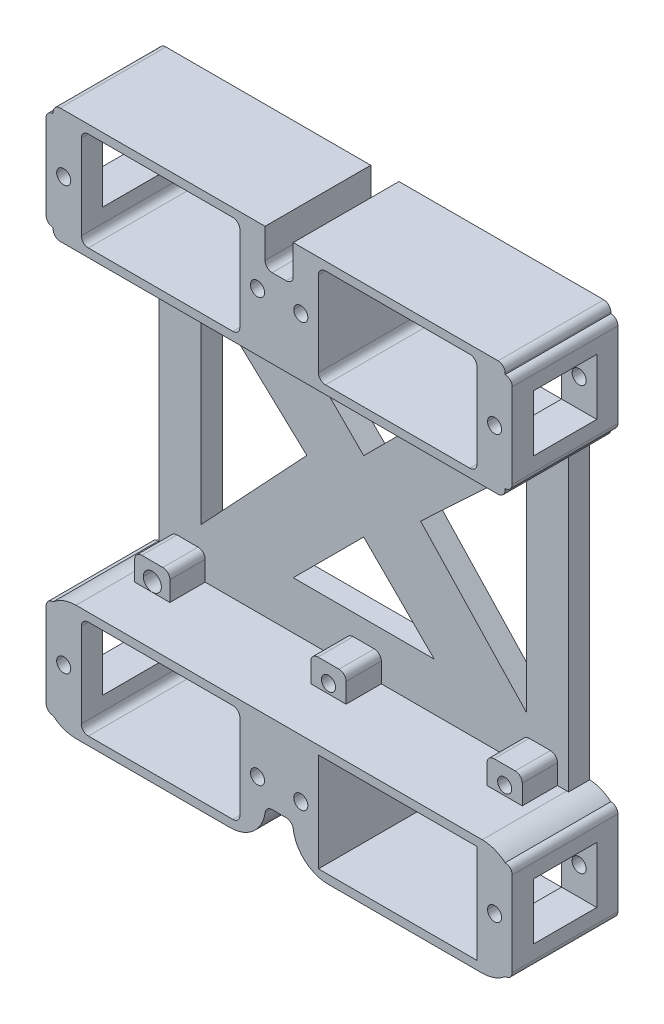
from build123d import *

# Parameters (mm, degrees)
BOSS_EXTRUDE2_START         = -15
BOSS_EXTRUDE2_OUTLINE_R     = 1
BOSS_EXTRUDE2_DEPTH         = 15
BOSS_EXTRUDE2_2_OUTLINE_W   = 58.142598029
BOSS_EXTRUDE2_2_OUTLINE_H   = 43.583150067
BOSS_EXTRUDE2_2_OUTLINE_R   = 1
BOSS_EXTRUDE2_2_OUTLINE_W_2 = 5
BOSS_EXTRUDE2_2_OUTLINE_H_2 = 8
BOSS_EXTRUDE2_2_DEPTH       = 3
BOSS_EXTRUDE2_START_2       = -12
BOSS_EXTRUDE2_3_OUTLINE_R   = 1
BOSS_EXTRUDE2_3_DEPTH       = 5
BOSS_EXTRUDE2_START_3       = -3
BOSS_EXTRUDE2_4_OUTLINE_W   = 5
BOSS_EXTRUDE2_4_OUTLINE_H   = 8
BOSS_EXTRUDE2_4_OUTLINE_R   = 1
BOSS_EXTRUDE2_4_DEPTH       = 3
CUT_EXTRUDE1_DEPTH          = 386.013637335
FILLET1_R                   = 5
FILLET2_R                   = 5
SKETCH3_W                   = 22.5
SKETCH3_H                   = 1
CUT_EXTRUDE2_DEPTH          = 386.013637462
FILLET3_R                   = 1
SKETCH4_W                   = 4
SKETCH4_H                   = 1.2
CUT_EXTRUDE3_DEPTH          = 386.013637462
FILLET4_R                   = 1
FILLET5_R                   = 1


with BuildPart() as part:
    # Boss-Extrude2: read off the stored shape, not the designer's step
    # Boss-Extrude2 outline → Boss-Extrude2 (new body)
    # profile 1 of 2: a face of its own
    with BuildSketch(Plane.XY.offset(95).offset(BOSS_EXTRUDE2_START)):
        with BuildLine():
            Line((-36.215449014, 311.14627107), (-100.358047043, 311.14627107))
            Line((-100.358047043, 311.14627107), (-100.358047043, 309.94627107))
            ThreePointArc((-100.358047043, 309.94627107), (-101.065153824, 309.653377852), (-101.358047043, 308.94627107))
            Line((-101.358047043, 308.94627107), (-101.358047043, 306.94627107))
            Line((-101.358047043, 306.94627107), (-96.358047043, 306.94627107))
            Line((-96.358047043, 306.94627107), (-96.358047043, 308.94627107))
            Line((-96.358047043, 308.94627107), (-73.858047043, 308.94627107))
            Line((-73.858047043, 308.94627107), (-73.858047043, 296.94627107))
            Line((-73.858047043, 296.94627107), (-96.358047043, 296.94627107))
            Line((-96.358047043, 296.94627107), (-96.358047043, 298.94627107))
            Line((-96.358047043, 298.94627107), (-101.358047043, 298.94627107))
            Line((-101.358047043, 298.94627107), (-101.358047043, 296.94627107))
            ThreePointArc((-101.358047043, 296.94627107), (-101.065153825, 296.239164288), (-100.358047043, 295.94627107))
            Line((-100.358047043, 295.94627107), (-100.358047043, 294.74627107))
            Line((-100.358047043, 294.74627107), (-36.215449014, 294.74627107))
            Line((-36.215449014, 294.74627107), (-36.215449014, 295.94627107))
            ThreePointArc((-36.215449014, 295.94627107), (-35.508342233, 296.239164289), (-35.215449014, 296.94627107))
            Line((-35.215449014, 296.94627107), (-35.215449014, 298.94627107))
            Line((-35.215449014, 298.94627107), (-40.215449014, 298.94627107))
            Line((-40.215449014, 298.94627107), (-40.215449014, 296.94627107))
            Line((-40.215449014, 296.94627107), (-62.715449014, 296.94627107))
            Line((-62.715449014, 296.94627107), (-62.715449014, 308.94627107))
            Line((-62.715449014, 308.94627107), (-40.215449014, 308.94627107))
            Line((-40.215449014, 308.94627107), (-40.215449014, 306.94627107))
            Line((-40.215449014, 306.94627107), (-35.215449014, 306.94627107))
            Line((-35.215449014, 306.94627107), (-35.215449014, 308.94627107))
            ThreePointArc((-35.215449014, 308.94627107), (-35.508342233, 309.653377851), (-36.215449014, 309.94627107))
            Line((-36.215449014, 309.94627107), (-36.215449014, 311.14627107))
        make_face()
        with BuildLine():
            Line((-71.254377112, 295.94627107), (-71.286747043, 295.94627107))
            ThreePointArc((-71.286747043, 295.94627107), (-71.270298041, 295.946406364), (-71.253853489, 295.946812209))
            Line((-71.253853489, 295.946812209), (-71.254377112, 295.94627107))
        make_face(mode=Mode.SUBTRACT)
        with Locations((-71.358047043, 302.94627107)):
            Circle(BOSS_EXTRUDE2_OUTLINE_R, mode=Mode.SUBTRACT)
        with BuildLine():
            Line((-70.286747043, 295.94627107), (-70.286747043, 298.94627107))
            ThreePointArc((-70.286747043, 298.94627107), (-69.993853824, 299.653377852), (-69.286747043, 299.94627107))
            Line((-69.286747043, 299.94627107), (-67.286747043, 299.94627107))
            ThreePointArc((-67.286747043, 299.94627107), (-66.579640262, 299.653377851), (-66.286747043, 298.94627107))
            Line((-66.286747043, 298.94627107), (-66.286747043, 295.94627107))
            Line((-66.286747043, 295.94627107), (-70.286747043, 295.94627107))
        make_face(mode=Mode.SUBTRACT)
        with Locations((-65.215449014, 302.94627107)):
            Circle(BOSS_EXTRUDE2_OUTLINE_R, mode=Mode.SUBTRACT)
    # profile 2 of 2: a face of its own
    with BuildSketch(Plane.XY.offset(95).offset(BOSS_EXTRUDE2_START)):
        with BuildLine():
            Line((-100.358047043, 354.729421137), (-36.215449014, 354.729421137))
            Line((-36.215449014, 354.729421137), (-36.215449014, 355.929421137))
            ThreePointArc((-36.215449014, 355.929421137), (-35.508342232, 356.222314355), (-35.215449014, 356.929421137))
            Line((-35.215449014, 356.929421137), (-35.215449014, 358.929421137))
            Line((-35.215449014, 358.929421137), (-40.215449014, 358.929421137))
            Line((-40.215449014, 358.929421137), (-40.215449014, 356.929421137))
            Line((-40.215449014, 356.929421137), (-62.715449014, 356.929421137))
            Line((-62.715449014, 356.929421137), (-62.715449014, 368.929421137))
            Line((-62.715449014, 368.929421137), (-40.215449014, 368.929421137))
            Line((-40.215449014, 368.929421137), (-40.215449014, 366.929421137))
            Line((-40.215449014, 366.929421137), (-35.215449014, 366.929421137))
            Line((-35.215449014, 366.929421137), (-35.215449014, 368.929421137))
            ThreePointArc((-35.215449014, 368.929421137), (-35.508342233, 369.636527918), (-36.215449014, 369.929421137))
            Line((-36.215449014, 369.929421137), (-36.215449014, 371.129421137))
            Line((-36.215449014, 371.129421137), (-100.358047043, 371.129421137))
            Line((-100.358047043, 371.129421137), (-100.358047043, 369.929421137))
            ThreePointArc((-100.358047043, 369.929421137), (-101.065153824, 369.636527919), (-101.358047043, 368.929421137))
            Line((-101.358047043, 368.929421137), (-101.358047043, 366.929421137))
            Line((-101.358047043, 366.929421137), (-96.358047043, 366.929421137))
            Line((-96.358047043, 366.929421137), (-96.358047043, 368.929421137))
            Line((-96.358047043, 368.929421137), (-73.858047043, 368.929421137))
            Line((-73.858047043, 368.929421137), (-73.858047043, 356.929421137))
            Line((-73.858047043, 356.929421137), (-96.358047043, 356.929421137))
            Line((-96.358047043, 356.929421137), (-96.358047043, 358.929421137))
            Line((-96.358047043, 358.929421137), (-101.358047043, 358.929421137))
            Line((-101.358047043, 358.929421137), (-101.358047043, 356.929421137))
            ThreePointArc((-101.358047043, 356.929421137), (-101.065153825, 356.222314355), (-100.358047043, 355.929421137))
            Line((-100.358047043, 355.929421137), (-100.358047043, 354.729421137))
        make_face()
        with Locations((-71.358047043, 362.929421137)):
            Circle(BOSS_EXTRUDE2_OUTLINE_R, mode=Mode.SUBTRACT)
        with BuildLine():
            Line((-71.254377112, 369.929421137), (-71.253853489, 369.928879997))
            ThreePointArc((-71.253853489, 369.928879997), (-71.270298041, 369.929285843), (-71.286747043, 369.929421137))
            Line((-71.286747043, 369.929421137), (-71.254377112, 369.929421137))
        make_face(mode=Mode.SUBTRACT)
        with Locations((-65.215449014, 362.929421137)):
            Circle(BOSS_EXTRUDE2_OUTLINE_R, mode=Mode.SUBTRACT)
        with BuildLine():
            Line((-70.286747043, 366.929421137), (-70.286747043, 369.929421137))
            Line((-70.286747043, 369.929421137), (-66.286747043, 369.929421137))
            Line((-66.286747043, 369.929421137), (-66.286747043, 366.929421137))
            ThreePointArc((-66.286747043, 366.929421137), (-66.579640261, 366.222314355), (-67.286747043, 365.929421137))
            Line((-67.286747043, 365.929421137), (-69.286747043, 365.929421137))
            ThreePointArc((-69.286747043, 365.929421137), (-69.993853825, 366.222314355), (-70.286747043, 366.929421137))
        make_face(mode=Mode.SUBTRACT)
    extrude(amount=BOSS_EXTRUDE2_DEPTH)

    # Boss-Extrude2 2 outline → Boss-Extrude2 2 (add)
    # profile 1 of 5: a face of its own
    with BuildSketch(Plane.XY.offset(95).offset(BOSS_EXTRUDE2_START)):
        with Locations((-68.286748028, 332.937846104)):
            Rectangle(BOSS_EXTRUDE2_2_OUTLINE_W, BOSS_EXTRUDE2_2_OUTLINE_H)
        Polygon((-78.286747043, 317.937846137), (-68.286747043, 327.937846137), (-58.286747043, 317.937846137), align=None, mode=Mode.SUBTRACT)
        Polygon((-91.358047043, 347.937846137), (-76.358047043, 333.93298957), (-91.358047043, 317.937846137), align=None, mode=Mode.SUBTRACT)
        Polygon((-45.215447043, 347.937846137), (-45.215447043, 317.937846137), (-60.215447043, 333.93298957), align=None, mode=Mode.SUBTRACT)
        Polygon((-68.286747043, 337.937846137), (-78.286747043, 347.937846137), (-58.286747043, 347.937846137), align=None, mode=Mode.SUBTRACT)
        with Locations((-93.286747043, 353.429421137)):
            Circle(BOSS_EXTRUDE2_2_OUTLINE_R, mode=Mode.SUBTRACT)
        with Locations((-68.286747043, 353.429421137)):
            Circle(BOSS_EXTRUDE2_2_OUTLINE_R, mode=Mode.SUBTRACT)
        with Locations((-43.286747043, 353.429421137)):
            Circle(BOSS_EXTRUDE2_2_OUTLINE_R, mode=Mode.SUBTRACT)
        with Locations((-43.286747043, 312.44627107)):
            Circle(BOSS_EXTRUDE2_2_OUTLINE_R, mode=Mode.SUBTRACT)
        with Locations((-68.286747043, 312.44627107)):
            Circle(BOSS_EXTRUDE2_2_OUTLINE_R, mode=Mode.SUBTRACT)
        with BuildLine():
            ThreePointArc((-92.00268291, 312.44627107), (-93.286747044, 311.162206937), (-94.570811177, 312.44627107))
            ThreePointArc((-94.570811177, 312.44627107), (-93.286747044, 313.730335203), (-92.00268291, 312.44627107))
        make_face(mode=Mode.SUBTRACT)
    # profile 2 of 5: a face of its own
    with BuildSketch(Plane.XY.offset(95).offset(BOSS_EXTRUDE2_START)):
        with Locations((-98.858047043, 302.94627107)):
            Rectangle(BOSS_EXTRUDE2_2_OUTLINE_W_2, BOSS_EXTRUDE2_2_OUTLINE_H_2)
        with Locations((-98.858047043, 302.94627107)):
            Circle(BOSS_EXTRUDE2_2_OUTLINE_R, mode=Mode.SUBTRACT)
    # profile 3 of 5: a face of its own
    with BuildSketch(Plane.XY.offset(95).offset(BOSS_EXTRUDE2_START)):
        with Locations((-98.858047043, 362.929421137)):
            Rectangle(BOSS_EXTRUDE2_2_OUTLINE_W_2, BOSS_EXTRUDE2_2_OUTLINE_H_2)
        with Locations((-98.858047043, 362.929421137)):
            Circle(BOSS_EXTRUDE2_2_OUTLINE_R, mode=Mode.SUBTRACT)
    # profile 4 of 5: a face of its own
    with BuildSketch(Plane.XY.offset(95).offset(BOSS_EXTRUDE2_START)):
        with Locations((-37.715449014, 302.94627107)):
            Rectangle(BOSS_EXTRUDE2_2_OUTLINE_W_2, BOSS_EXTRUDE2_2_OUTLINE_H_2)
        with Locations((-37.715449014, 302.94627107)):
            Circle(BOSS_EXTRUDE2_2_OUTLINE_R, mode=Mode.SUBTRACT)
    # profile 5 of 5: a face of its own
    with BuildSketch(Plane.XY.offset(95).offset(BOSS_EXTRUDE2_START)):
        with Locations((-37.715449014, 362.929421137)):
            Rectangle(BOSS_EXTRUDE2_2_OUTLINE_W_2, BOSS_EXTRUDE2_2_OUTLINE_H_2)
        with Locations((-37.715449014, 362.929421137)):
            Circle(BOSS_EXTRUDE2_2_OUTLINE_R, mode=Mode.SUBTRACT)
    extrude(amount=BOSS_EXTRUDE2_2_DEPTH)

    # Boss-Extrude2 3 outline → Boss-Extrude2 3 (add)
    # profile 1 of 6: a face of its own
    with BuildSketch(Plane.XY.offset(95).offset(BOSS_EXTRUDE2_START_2)):
        with BuildLine():
            Line((-95.786747043, 313.94627107), (-95.786747043, 311.14627107))
            Line((-95.786747043, 311.14627107), (-90.786747043, 311.14627107))
            Line((-90.786747043, 311.14627107), (-90.786747043, 313.94627107))
            ThreePointArc((-90.786747043, 313.94627107), (-91.079640262, 314.653377851), (-91.786747043, 314.94627107))
            Line((-91.786747043, 314.94627107), (-94.786747043, 314.94627107))
            ThreePointArc((-94.786747043, 314.94627107), (-95.493853824, 314.653377852), (-95.786747043, 313.94627107))
        make_face()
        with BuildLine():
            ThreePointArc((-92.00268291, 312.44627107), (-93.286747044, 311.162206937), (-94.570811177, 312.44627107))
            ThreePointArc((-94.570811177, 312.44627107), (-93.286747044, 313.730335203), (-92.00268291, 312.44627107))
        make_face(mode=Mode.SUBTRACT)
    # profile 2 of 6: a face of its own
    with BuildSketch(Plane.XY.offset(95).offset(BOSS_EXTRUDE2_START_2)):
        with BuildLine():
            Line((-70.786747043, 313.94627107), (-70.786747043, 311.14627107))
            Line((-70.786747043, 311.14627107), (-65.786747043, 311.14627107))
            Line((-65.786747043, 311.14627107), (-65.786747043, 313.94627107))
            ThreePointArc((-65.786747043, 313.94627107), (-66.079640262, 314.653377851), (-66.786747043, 314.94627107))
            Line((-66.786747043, 314.94627107), (-69.786747043, 314.94627107))
            ThreePointArc((-69.786747043, 314.94627107), (-70.493853824, 314.653377852), (-70.786747043, 313.94627107))
        make_face()
        with Locations((-68.286747043, 312.44627107)):
            Circle(BOSS_EXTRUDE2_3_OUTLINE_R, mode=Mode.SUBTRACT)
    # profile 3 of 6: a face of its own
    with BuildSketch(Plane.XY.offset(95).offset(BOSS_EXTRUDE2_START_2)):
        with BuildLine():
            Line((-90.786747043, 354.729421137), (-95.786747043, 354.729421137))
            Line((-95.786747043, 354.729421137), (-95.786747043, 351.929421137))
            ThreePointArc((-95.786747043, 351.929421137), (-95.493853825, 351.222314355), (-94.786747043, 350.929421137))
            Line((-94.786747043, 350.929421137), (-91.786747043, 350.929421137))
            ThreePointArc((-91.786747043, 350.929421137), (-91.079640261, 351.222314355), (-90.786747043, 351.929421137))
            Line((-90.786747043, 351.929421137), (-90.786747043, 354.729421137))
        make_face()
        with Locations((-93.286747043, 353.429421137)):
            Circle(BOSS_EXTRUDE2_3_OUTLINE_R, mode=Mode.SUBTRACT)
    # profile 4 of 6: a face of its own
    with BuildSketch(Plane.XY.offset(95).offset(BOSS_EXTRUDE2_START_2)):
        with BuildLine():
            Line((-45.786747043, 313.94627107), (-45.786747043, 311.14627107))
            Line((-45.786747043, 311.14627107), (-40.786747043, 311.14627107))
            Line((-40.786747043, 311.14627107), (-40.786747043, 313.94627107))
            ThreePointArc((-40.786747043, 313.94627107), (-41.079640262, 314.653377851), (-41.786747043, 314.94627107))
            Line((-41.786747043, 314.94627107), (-44.786747043, 314.94627107))
            ThreePointArc((-44.786747043, 314.94627107), (-45.493853824, 314.653377852), (-45.786747043, 313.94627107))
        make_face()
        with Locations((-43.286747043, 312.44627107)):
            Circle(BOSS_EXTRUDE2_3_OUTLINE_R, mode=Mode.SUBTRACT)
    # profile 5 of 6: a face of its own
    with BuildSketch(Plane.XY.offset(95).offset(BOSS_EXTRUDE2_START_2)):
        with BuildLine():
            Line((-65.786747043, 354.729421137), (-70.786747043, 354.729421137))
            Line((-70.786747043, 354.729421137), (-70.786747043, 351.929421137))
            ThreePointArc((-70.786747043, 351.929421137), (-70.493853825, 351.222314355), (-69.786747043, 350.929421137))
            Line((-69.786747043, 350.929421137), (-66.786747043, 350.929421137))
            ThreePointArc((-66.786747043, 350.929421137), (-66.079640261, 351.222314355), (-65.786747043, 351.929421137))
            Line((-65.786747043, 351.929421137), (-65.786747043, 354.729421137))
        make_face()
        with Locations((-68.286747043, 353.429421137)):
            Circle(BOSS_EXTRUDE2_3_OUTLINE_R, mode=Mode.SUBTRACT)
    # profile 6 of 6: a face of its own
    with BuildSketch(Plane.XY.offset(95).offset(BOSS_EXTRUDE2_START_2)):
        with BuildLine():
            Line((-40.786747043, 354.729421137), (-45.786747043, 354.729421137))
            Line((-45.786747043, 354.729421137), (-45.786747043, 351.929421137))
            ThreePointArc((-45.786747043, 351.929421137), (-45.493853825, 351.222314355), (-44.786747043, 350.929421137))
            Line((-44.786747043, 350.929421137), (-41.786747043, 350.929421137))
            ThreePointArc((-41.786747043, 350.929421137), (-41.079640261, 351.222314355), (-40.786747043, 351.929421137))
            Line((-40.786747043, 351.929421137), (-40.786747043, 354.729421137))
        make_face()
        with Locations((-43.286747043, 353.429421137)):
            Circle(BOSS_EXTRUDE2_3_OUTLINE_R, mode=Mode.SUBTRACT)
    extrude(amount=BOSS_EXTRUDE2_3_DEPTH)

    # Boss-Extrude2 4 outline → Boss-Extrude2 4 (add)
    # profile 1 of 4: a face of its own
    with BuildSketch(Plane.XY.offset(95).offset(BOSS_EXTRUDE2_START_3)):
        with Locations((-98.858047043, 302.94627107)):
            Rectangle(BOSS_EXTRUDE2_4_OUTLINE_W, BOSS_EXTRUDE2_4_OUTLINE_H)
        with Locations((-98.858047043, 302.94627107)):
            Circle(BOSS_EXTRUDE2_4_OUTLINE_R, mode=Mode.SUBTRACT)
    # profile 2 of 4: a face of its own
    with BuildSketch(Plane.XY.offset(95).offset(BOSS_EXTRUDE2_START_3)):
        with Locations((-98.858047043, 362.929421137)):
            Rectangle(BOSS_EXTRUDE2_4_OUTLINE_W, BOSS_EXTRUDE2_4_OUTLINE_H)
        with Locations((-98.858047043, 362.929421137)):
            Circle(BOSS_EXTRUDE2_4_OUTLINE_R, mode=Mode.SUBTRACT)
    # profile 3 of 4: a face of its own
    with BuildSketch(Plane.XY.offset(95).offset(BOSS_EXTRUDE2_START_3)):
        with Locations((-37.715449014, 302.94627107)):
            Rectangle(BOSS_EXTRUDE2_4_OUTLINE_W, BOSS_EXTRUDE2_4_OUTLINE_H)
        with Locations((-37.715449014, 302.94627107)):
            Circle(BOSS_EXTRUDE2_4_OUTLINE_R, mode=Mode.SUBTRACT)
    # profile 4 of 4: a face of its own
    with BuildSketch(Plane.XY.offset(95).offset(BOSS_EXTRUDE2_START_3)):
        with Locations((-37.715449014, 362.929421137)):
            Rectangle(BOSS_EXTRUDE2_4_OUTLINE_W, BOSS_EXTRUDE2_4_OUTLINE_H)
        with Locations((-37.715449014, 362.929421137)):
            Circle(BOSS_EXTRUDE2_4_OUTLINE_R, mode=Mode.SUBTRACT)
    extrude(amount=BOSS_EXTRUDE2_4_DEPTH)

    # Sketch2 → Cut-Extrude1 (cut, through all)
    with BuildSketch(Plane.XY.offset(95)):
        Polygon((-70.286747043, 295.94627107), (-70.286747043, 294.74627107), (-66.286747043, 295.94627107), align=None)
        Polygon((-66.286747043, 295.94627107), (-70.286747043, 294.74627107), (-66.286747043, 294.74627107), align=None)
    extrude(amount=-CUT_EXTRUDE1_DEPTH, mode=Mode.SUBTRACT)

    # Fillet1
    fillet1_edges = [part.edges().sort_by_distance(p)[0] for p in [
        (-66.286747043, 294.74627107, 87.5),
        (-70.286747043, 294.74627107, 87.5),
    ]]
    fillet(fillet1_edges, radius=FILLET1_R)

    # Fillet2
    # the kernel refuses this fillet: 5 mm, written as the material it takes off along each edge
    with BuildSketch(Plane(origin=(-36.215449014, 294.74627107, 71.875961595), x_dir=(-1, 0, 0), z_dir=(0, 0, 1))) as fillet2_piece_1:
        with BuildLine():
            CenterArc((3.249615362, -5), FILLET2_R, 90, 40.535802111)
            Line((0, -1.2), (0, 0))
            Line((0, 0), (3.249615362, 0))
        make_face()
    extrude(amount=31.248076809, mode=Mode.SUBTRACT)
    with BuildSketch(Plane(origin=(-36.215449014, 311.14627107, 71.875961595), x_dir=(0, -1, 0), z_dir=(0, 0, 1))) as fillet2_piece_2_section:
        with BuildLine():
            CenterArc((5, -3.249615362), FILLET2_R, 139.464197889, 40.535802111)
            Line((0, -3.249615362), (0, 0))
            Line((0, 0), (1.2, 0))
        make_face()
    fillet2_piece_2 = extrude(amount=31.248076809, mode=Mode.PRIVATE)
    fillet2_piece_2 = split(fillet2_piece_2, bisect_by=Plane(origin=(-39.215449014, 311.14627107, 71.875961595), z_dir=(1, 0, 0)), keep=Keep.TOP, mode=Mode.PRIVATE)
    add(fillet2_piece_2, mode=Mode.SUBTRACT)
    with BuildSketch(Plane(origin=(-36.215449014, 311.14627107, 71.875961595), x_dir=(0, -1, 0), z_dir=(0, 0, 1))) as fillet2_piece_3_section:
        with BuildLine():
            CenterArc((5, -3.249615362), FILLET2_R, 139.464197889, 40.535802111)
            Line((0, -3.249615362), (0, 0))
            Line((0, 0), (1.2, 0))
        make_face()
    fillet2_piece_3 = extrude(amount=31.248076809, mode=Mode.PRIVATE)
    fillet2_piece_3 = split(fillet2_piece_3, bisect_by=Plane(origin=(-36.215449014, 311.14627107, 83), z_dir=(0, 0, 1)), keep=Keep.TOP, mode=Mode.PRIVATE)
    add(fillet2_piece_3, mode=Mode.SUBTRACT)
    with BuildSketch(Plane(origin=(-100.358047043, 311.14627107, 71.875961595), x_dir=(1, 0, 0), z_dir=(0, 0, 1))) as fillet2_piece_4_section:
        with BuildLine():
            CenterArc((3.249615362, -5), FILLET2_R, 90, 40.535802111)
            Line((0, -1.2), (0, 0))
            Line((0, 0), (3.249615362, 0))
        make_face()
    fillet2_piece_4 = extrude(amount=31.248076809, mode=Mode.PRIVATE)
    fillet2_piece_4 = split(fillet2_piece_4, bisect_by=Plane(origin=(-97.358047043, 311.14627107, 71.875961595), z_dir=(-1, 0, 0)), keep=Keep.TOP, mode=Mode.PRIVATE)
    add(fillet2_piece_4, mode=Mode.SUBTRACT)
    with BuildSketch(Plane(origin=(-100.358047043, 311.14627107, 71.875961595), x_dir=(1, 0, 0), z_dir=(0, 0, 1))) as fillet2_piece_5_section:
        with BuildLine():
            CenterArc((3.249615362, -5), FILLET2_R, 90, 40.535802111)
            Line((0, -1.2), (0, 0))
            Line((0, 0), (3.249615362, 0))
        make_face()
    fillet2_piece_5 = extrude(amount=31.248076809, mode=Mode.PRIVATE)
    fillet2_piece_5 = split(fillet2_piece_5, bisect_by=Plane(origin=(-100.358047043, 311.14627107, 83), z_dir=(0, 0, 1)), keep=Keep.TOP, mode=Mode.PRIVATE)
    add(fillet2_piece_5, mode=Mode.SUBTRACT)
    with BuildSketch(Plane(origin=(-100.358047043, 294.74627107, 71.875961595), x_dir=(1, 0, 0), z_dir=(0, 0, 1))) as fillet2_piece_6:
        with BuildLine():
            CenterArc((3.249615362, 5), FILLET2_R, 229.464197889, 40.535802111)
            Line((0, 1.2), (0, 0))
            Line((0, 0), (3.249615362, 0))
        make_face()
    extrude(amount=31.248076809, mode=Mode.SUBTRACT)

    # Sketch3 → Cut-Extrude2 (cut, through all)
    with BuildSketch(Plane.XY.offset(95)):
        with Locations((-85.108047043, 309.44627107)):
            Rectangle(SKETCH3_W, SKETCH3_H)
        with Locations((-85.108047043, 296.44627107)):
            Rectangle(SKETCH3_W, SKETCH3_H)
        with Locations((-51.465447043, 296.44627107)):
            Rectangle(SKETCH3_W, SKETCH3_H)
        with Locations((-51.465447043, 309.44627107)):
            Rectangle(SKETCH3_W, SKETCH3_H)
        with Locations((-51.465447043, 369.429421137)):
            Rectangle(SKETCH3_W, SKETCH3_H)
        with Locations((-51.465447043, 356.429421137)):
            Rectangle(SKETCH3_W, SKETCH3_H)
        with Locations((-85.108047043, 356.429421137)):
            Rectangle(SKETCH3_W, SKETCH3_H)
        with Locations((-85.108047043, 369.429421137)):
            Rectangle(SKETCH3_W, SKETCH3_H)
    extrude(amount=-CUT_EXTRUDE2_DEPTH, mode=Mode.SUBTRACT)

    # Fillet3
    fillet3_edges = [part.edges().sort_by_distance(p)[0] for p in [
        (-73.858047043, 295.94627107, 87.5),
        (-96.358047043, 295.94627107, 87.5),
        (-96.358047043, 309.94627107, 87.5),
        (-73.858047043, 309.94627107, 87.5),
    ]]
    fillet(fillet3_edges, radius=FILLET3_R)

    # Sketch4 → Cut-Extrude3 (cut, through all)
    with BuildSketch(Plane.XY.offset(95)):
        with Locations((-68.286747043, 370.529421137)):
            Rectangle(SKETCH4_W, SKETCH4_H)
    extrude(amount=-CUT_EXTRUDE3_DEPTH, mode=Mode.SUBTRACT)

    # Fillet4
    # the kernel refuses this fillet: 1 mm, written as the material it adds along each edge
    with BuildSketch(Plane(origin=(-40.215447043, 369.929421137, 95), x_dir=(0, -1, 0), z_dir=(0, 0, -1)), Plane(origin=(-62.715447043, 369.929421137, 95), x_dir=(1, 0, 0), z_dir=(0, 0, -1)), Plane(origin=(-73.858047043, 355.929421137, 95), x_dir=(-1, 0, 0), z_dir=(0, 0, -1)), Plane(origin=(-96.358047043, 355.929421137, 95), x_dir=(4.959019861416891e-10, 1.0, 0), z_dir=(0, 0, -1))) as fillet4_piece_1:
        with BuildLine():
            CenterArc((FILLET4_R, FILLET4_R), FILLET4_R, 180, 90)
            Line((0, FILLET4_R), (0, 0))
            Line((0, 0), (FILLET4_R, 0))
        make_face()
    extrude(amount=15)
    with BuildSketch(Plane(origin=(-62.715447043, 355.929421137, 95), x_dir=(1, 0, 0), z_dir=(0, 0, -1)), Plane(origin=(-40.215447043, 355.929421137, 95), x_dir=(0, 1, 0), z_dir=(0, 0, -1)), Plane(origin=(-96.358047043, 369.929421137, 95), x_dir=(4.959019861416891e-10, -1.0, 0), z_dir=(0, 0, -1)), Plane(origin=(-73.858047043, 369.929421137, 95), x_dir=(-1, 0, 0), z_dir=(0, 0, -1))) as fillet4_piece_2:
        with BuildLine():
            CenterArc((FILLET4_R, -FILLET4_R), FILLET4_R, 90, 90)
            Line((0, -FILLET4_R), (0, 0))
            Line((0, 0), (FILLET4_R, 0))
        make_face()
    extrude(amount=15)

    # Fillet5
    fillet5_edges = [part.edges().sort_by_distance(p)[0] for p in [
        (-36.215449014, 354.729421137, 87.5),
        (-100.358047043, 354.729421137, 87.5),
        (-100.358047043, 371.129421137, 87.5),
        (-36.215449014, 371.129421137, 87.5),
    ]]
    fillet(fillet5_edges, radius=FILLET5_R)


solid = part.part
